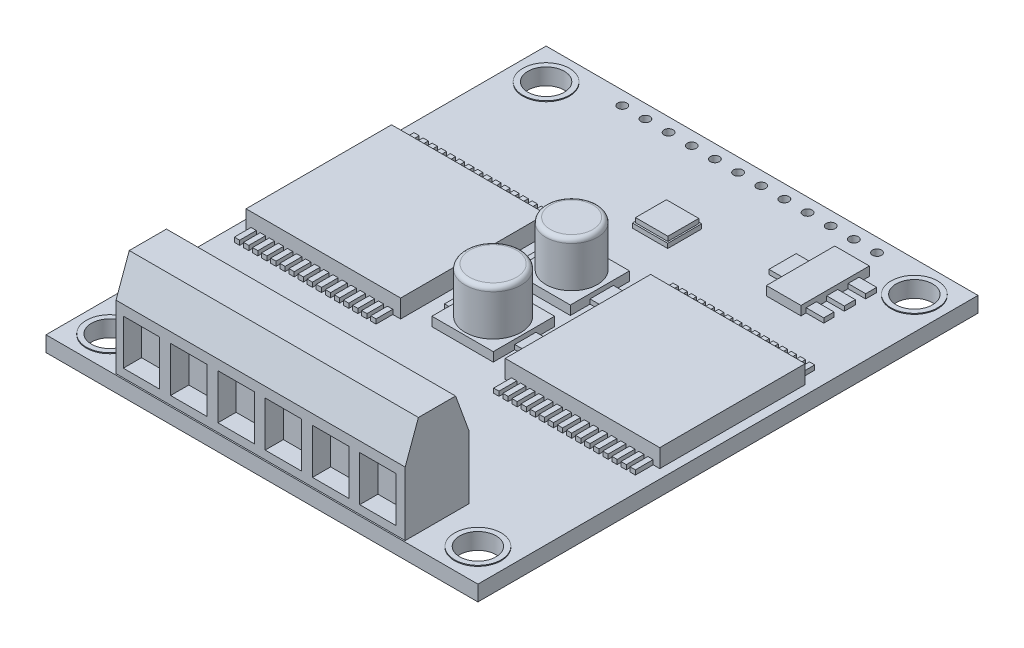
from build123d import *
from OCP.BRepFilletAPI import BRepFilletAPI_MakeChamfer

# Parameters (mm, degrees)
ESBO_O1_W                = 47.5
ESBO_O1_H                = 55
RESSALTO_EXTRUS_O1_DEPTH = 1.7
ESBO_O2_R                = 2
ESBO_O2_R_2              = 1.25
ESBO_O2_R_3              = 0.5
CORTE_EXTRUS_O1_DEPTH    = 73.692090354
ESBO_O3_W                = 17
ESBO_O3_H                = 16
ESBO_O3_W_2              = 5.212797126
ESBO_O3_H_2              = 4.901585357
ESBO_O3_W_3              = 5.212797125
RESSALTO_EXTRUS_O2_DEPTH = 2
ESBO_O4_W                = 6.746375984
ESBO_O4_H                = 6.746375983
ESBO_O4_W_2              = 6.5
ESBO_O4_H_2              = 6.5
ESBO_O4_W_3              = 3.55801489
ESBO_O4_H_3              = 3.39628694
ESBO_O4_W_4              = 3.800606814
ESBO_O4_H_4              = 7.520349653
RESSALTO_EXTRUS_O3_DEPTH = 1
ESBO_O5_R                = 2.835881987
ESBO_O5_R_2              = 3.075092367
RESSALTO_EXTRUS_O4_DEPTH = 5
ESBO_O6_W                = 3.112117687
ESBO_O6_H                = 0.933635306
ESBO_O6_W_2              = 1.400452959
ESBO_O6_H_2              = 3.423329455
ESBO_O6_W_3              = 1.633861785
ESBO_O6_W_4              = 2.800905918
ESBO_O6_W_5              = 2.334088265
ESBO_O6_H_3              = 2.334088265
ESBO_O6_W_6              = 2.022876496
ESBO_O6_H_4              = 2.567497092
ESBO_O6_W_7              = 2.830239116
ESBO_O6_H_5              = 1.212959621
ESBO_O6_H_6              = 1.212959622
ESBO_O6_H_7              = 1.132095647
ESBO_O6_W_8              = 2.627815609
ESBO_O6_H_8              = 2.991967067
ESBO_O6_W_9              = 3.876988277
ESBO_O6_H_9              = 3.739221997
ESBO_O6_W_10             = 0.584875685
ESBO_O6_H_10             = 2.392673258
ESBO_O6_H_11             = 2.392673259
ESBO_O6_W_11             = 0.584875686
RESSALTO_EXTRUS_O5_DEPTH = 0.5
FILETE1_R                = 0.5
RESSALTO_EXTRUS_O6_START = 0.1
ESBO_O7_R                = 2.561974419
ESBO_O7_R_2              = 2
ESBO_O7_R_3              = 1.492713004
ESBO_O7_R_4              = 1.25
RESSALTO_EXTRUS_O6_DEPTH = 0.1
ESBO_O8_W                = 31.8
ESBO_O8_H                = 7
RESSALTO_EXTRUS_O7_DEPTH = 11
CHANFRO1_SIZE            = 4
CHANFRO1_SIZE2           = 1.455880937
ESBO_O10_W               = 4
ESBO_O10_H               = 4.965045717
CORTE_EXTRUS_O2_DEPTH    = 2


with BuildPart() as part:
    # Esboço1 → Ressalto-extrusão1 (new body)
    with BuildSketch(Plane(origin=(0, 0, 0), x_dir=(1, 0, 0), z_dir=(0, 1, 0))):
        with Locations((23.75, 27.5)):
            Rectangle(ESBO_O1_W, ESBO_O1_H)
    extrude(amount=RESSALTO_EXTRUS_O1_DEPTH)

    # Esboço2 → Corte-extrusão1 (cut, through all)
    with BuildSketch(Plane(origin=(0, 1.7, 0), x_dir=(1, 0, 0), z_dir=(0, 1, 0))):
        with Locations((3.5, 51.5)):
            Circle(ESBO_O2_R)
        with Locations((44, 51.5)):
            Circle(ESBO_O2_R)
        with Locations((3.5, 3.5)):
            Circle(ESBO_O2_R)
        with Locations((44, 3.5)):
            Circle(ESBO_O2_R)
        with Locations((12.5, 4.25)):
            Circle(ESBO_O2_R_2)
        with Locations((17, 4.25)):
            Circle(ESBO_O2_R_2)
        with Locations((21.5, 4.25)):
            Circle(ESBO_O2_R_2)
        with Locations((26, 4.25)):
            Circle(ESBO_O2_R_2)
        with Locations((30.5, 4.25)):
            Circle(ESBO_O2_R_2)
        with Locations((35, 4.25)):
            Circle(ESBO_O2_R_2)
        with Locations((9.862, 53.515053231)):
            Circle(ESBO_O2_R_3)
        with Locations((12.409090909, 53.515053231)):
            Circle(ESBO_O2_R_3)
        with Locations((14.956181818, 53.515053231)):
            Circle(ESBO_O2_R_3)
        with Locations((17.503272727, 53.515053231)):
            Circle(ESBO_O2_R_3)
        with Locations((20.050363636, 53.515053231)):
            Circle(ESBO_O2_R_3)
        with Locations((22.597454545, 53.515053231)):
            Circle(ESBO_O2_R_3)
        with Locations((25.144545455, 53.515053231)):
            Circle(ESBO_O2_R_3)
        with Locations((27.691636364, 53.515053231)):
            Circle(ESBO_O2_R_3)
        with Locations((30.238727273, 53.515053231)):
            Circle(ESBO_O2_R_3)
        with Locations((32.785818182, 53.515053231)):
            Circle(ESBO_O2_R_3)
        with Locations((35.332909091, 53.515053231)):
            Circle(ESBO_O2_R_3)
        with Locations((37.88, 53.515053231)):
            Circle(ESBO_O2_R_3)
    extrude(amount=-CORTE_EXTRUS_O1_DEPTH, mode=Mode.SUBTRACT)

    # Esboço3 → Ressalto-extrusão2 (add)
    with BuildSketch(Plane(origin=(0, 1.7, 0), x_dir=(1, 0, 0), z_dir=(0, 1, 0))):
        with Locations((9.5, 29)):
            Rectangle(ESBO_O3_W, ESBO_O3_H)
        with Locations((38, 29)):
            Rectangle(ESBO_O3_W, ESBO_O3_H)
        with Locations((21.512067959, 10.033239484)):
            Rectangle(ESBO_O3_W_2, ESBO_O3_H_2)
        with Locations((29.136756292, 9.994338013)):
            Rectangle(ESBO_O3_W_3, ESBO_O3_H_2)
    extrude(amount=RESSALTO_EXTRUS_O2_DEPTH)

    # Esboço4 → Ressalto-extrusão3 (add)
    with BuildSketch(Plane(origin=(0, 1.7, 0), x_dir=(1, 0, 0), z_dir=(0, 1, 0))):
        with Locations((23.827802942, 25.360419091)):
            Rectangle(ESBO_O4_W, ESBO_O4_H)
        with Locations((23.75, 33.918742729)):
            Rectangle(ESBO_O4_W_2, ESBO_O4_H_2)
        with Locations((24.033023912, 44.279274764)):
            Rectangle(ESBO_O4_W_3, ESBO_O4_H_3)
        with Locations((37.820331609, 47.069081893)):
            Rectangle(ESBO_O4_W_4, ESBO_O4_H_4)
    extrude(amount=RESSALTO_EXTRUS_O3_DEPTH)

    # Esboço5 → Ressalto-extrusão4 (add)
    with BuildSketch(Plane(origin=(0, 2.7, 0), x_dir=(1, 0, 0), z_dir=(0, 1, 0))):
        with Locations((23.709511319, 34.100766284)):
            Circle(ESBO_O5_R)
        with Locations((23.823248313, 25.349228892)):
            Circle(ESBO_O5_R_2)
    extrude(amount=RESSALTO_EXTRUS_O4_DEPTH)

    # Esboço6 → Ressalto-extrusão5 (add)
    with BuildSketch(Plane(origin=(0, 1.7, 0), x_dir=(1, 0, 0), z_dir=(0, 1, 0))):
        with Locations((32.463929523, 11.3558895)):
            Rectangle(ESBO_O6_W, ESBO_O6_H)
        with Locations((32.463929523, 8.866195351)):
            Rectangle(ESBO_O6_W, ESBO_O6_H)
        with Locations((26.395300033, 10.111042426)):
            Rectangle(ESBO_O6_W_2, ESBO_O6_H_2)
        with Locations((24.022310298, 10.111042426)):
            Rectangle(ESBO_O6_W_3, ESBO_O6_H_2)
        with Locations((18.070385222, 11.3558895)):
            Rectangle(ESBO_O6_W_4, ESBO_O6_H)
        with Locations((18.070385222, 8.866195351)):
            Rectangle(ESBO_O6_W_4, ESBO_O6_H)
        with Locations((26.862117686, 25.516024975)):
            Rectangle(ESBO_O6_W_5, ESBO_O6_H_3)
        with Locations((20.482276429, 25.516024975)):
            Rectangle(ESBO_O6_W_6, ESBO_O6_H_3)
        with Locations((26.862117686, 34.113250084)):
            Rectangle(ESBO_O6_W_5, ESBO_O6_H_4)
        with Locations((20.482276429, 34.113250084)):
            Rectangle(ESBO_O6_W_6, ESBO_O6_H_4)
        with Locations((40.246250852, 49.090681262)):
            Rectangle(ESBO_O6_W_7, ESBO_O6_H_5)
        with Locations((40.246250852, 46.745625994)):
            Rectangle(ESBO_O6_W_7, ESBO_O6_H_6)
        with Locations((40.246250852, 44.441002714)):
            Rectangle(ESBO_O6_W_7, ESBO_O6_H_7)
        with Locations((35.33389617, 46.988217918)):
            Rectangle(ESBO_O6_W_8, ESBO_O6_H_8)
        with Locations((24.038752716, 44.269535185)):
            Rectangle(ESBO_O6_W_9, ESBO_O6_H_9)
        with Locations((2.845211635, 20.357062722)):
            Rectangle(ESBO_O6_W_10, ESBO_O6_H_10)
        with Locations((1.845211635, 20.357062722)):
            Rectangle(ESBO_O6_W_10, ESBO_O6_H_10)
        with Locations((3.845211635, 20.357062722)):
            Rectangle(ESBO_O6_W_10, ESBO_O6_H_10)
        with Locations((4.845211635, 20.357062722)):
            Rectangle(ESBO_O6_W_10, ESBO_O6_H_10)
        with Locations((5.845211635, 20.357062722)):
            Rectangle(ESBO_O6_W_10, ESBO_O6_H_10)
        with Locations((6.845211635, 20.357062722)):
            Rectangle(ESBO_O6_W_10, ESBO_O6_H_10)
        with Locations((7.845211635, 20.357062722)):
            Rectangle(ESBO_O6_W_10, ESBO_O6_H_10)
        with Locations((8.845211635, 20.357062722)):
            Rectangle(ESBO_O6_W_10, ESBO_O6_H_10)
        with Locations((9.845211635, 20.357062722)):
            Rectangle(ESBO_O6_W_10, ESBO_O6_H_10)
        with Locations((10.845211635, 20.357062722)):
            Rectangle(ESBO_O6_W_10, ESBO_O6_H_10)
        with Locations((11.845211635, 20.357062722)):
            Rectangle(ESBO_O6_W_10, ESBO_O6_H_10)
        with Locations((12.845211635, 20.357062722)):
            Rectangle(ESBO_O6_W_10, ESBO_O6_H_10)
        with Locations((13.845211635, 20.357062722)):
            Rectangle(ESBO_O6_W_10, ESBO_O6_H_10)
        with Locations((14.845211635, 20.357062722)):
            Rectangle(ESBO_O6_W_10, ESBO_O6_H_10)
        with Locations((15.845211635, 20.357062722)):
            Rectangle(ESBO_O6_W_10, ESBO_O6_H_10)
        with Locations((16.845211635, 20.357062722)):
            Rectangle(ESBO_O6_W_10, ESBO_O6_H_10)
        with Locations((2.767818388, 37.789317955)):
            Rectangle(ESBO_O6_W_10, ESBO_O6_H_11)
        with Locations((1.767818388, 37.789317955)):
            Rectangle(ESBO_O6_W_10, ESBO_O6_H_11)
        with Locations((3.767818388, 37.789317955)):
            Rectangle(ESBO_O6_W_10, ESBO_O6_H_11)
        with Locations((4.767818388, 37.789317955)):
            Rectangle(ESBO_O6_W_10, ESBO_O6_H_11)
        with Locations((5.767818388, 37.789317955)):
            Rectangle(ESBO_O6_W_10, ESBO_O6_H_11)
        with Locations((6.767818388, 37.789317955)):
            Rectangle(ESBO_O6_W_10, ESBO_O6_H_11)
        with Locations((7.767818388, 37.789317955)):
            Rectangle(ESBO_O6_W_10, ESBO_O6_H_11)
        with Locations((8.767818388, 37.789317955)):
            Rectangle(ESBO_O6_W_10, ESBO_O6_H_11)
        with Locations((9.767818388, 37.789317955)):
            Rectangle(ESBO_O6_W_10, ESBO_O6_H_11)
        with Locations((10.767818388, 37.789317955)):
            Rectangle(ESBO_O6_W_10, ESBO_O6_H_11)
        with Locations((11.767818388, 37.789317955)):
            Rectangle(ESBO_O6_W_10, ESBO_O6_H_11)
        with Locations((12.767818388, 37.789317955)):
            Rectangle(ESBO_O6_W_10, ESBO_O6_H_11)
        with Locations((13.767818388, 37.789317955)):
            Rectangle(ESBO_O6_W_10, ESBO_O6_H_11)
        with Locations((14.767818388, 37.789317955)):
            Rectangle(ESBO_O6_W_10, ESBO_O6_H_11)
        with Locations((15.767818388, 37.789317955)):
            Rectangle(ESBO_O6_W_10, ESBO_O6_H_11)
        with Locations((16.767818388, 37.789317955)):
            Rectangle(ESBO_O6_W_10, ESBO_O6_H_11)
        with Locations((31.485086274, 20.237004075)):
            Rectangle(ESBO_O6_W_10, ESBO_O6_H_10)
        with Locations((30.485086274, 20.237004075)):
            Rectangle(ESBO_O6_W_10, ESBO_O6_H_10)
        with Locations((32.485086274, 20.237004075)):
            Rectangle(ESBO_O6_W_10, ESBO_O6_H_10)
        with Locations((33.485086274, 20.237004075)):
            Rectangle(ESBO_O6_W_10, ESBO_O6_H_10)
        with Locations((34.485086274, 20.237004075)):
            Rectangle(ESBO_O6_W_10, ESBO_O6_H_10)
        with Locations((35.485086274, 20.237004075)):
            Rectangle(ESBO_O6_W_10, ESBO_O6_H_10)
        with Locations((36.485086274, 20.237004075)):
            Rectangle(ESBO_O6_W_10, ESBO_O6_H_10)
        with Locations((37.485086274, 20.237004075)):
            Rectangle(ESBO_O6_W_10, ESBO_O6_H_10)
        with Locations((38.485086274, 20.237004075)):
            Rectangle(ESBO_O6_W_10, ESBO_O6_H_10)
        with Locations((39.485086274, 20.237004075)):
            Rectangle(ESBO_O6_W_10, ESBO_O6_H_10)
        with Locations((40.485086274, 20.237004075)):
            Rectangle(ESBO_O6_W_10, ESBO_O6_H_10)
        with Locations((41.485086274, 20.237004075)):
            Rectangle(ESBO_O6_W_10, ESBO_O6_H_10)
        with Locations((42.485086274, 20.237004075)):
            Rectangle(ESBO_O6_W_10, ESBO_O6_H_10)
        with Locations((43.485086274, 20.237004075)):
            Rectangle(ESBO_O6_W_10, ESBO_O6_H_10)
        with Locations((44.485086274, 20.237004075)):
            Rectangle(ESBO_O6_W_10, ESBO_O6_H_10)
        with Locations((45.485086274, 20.237004075)):
            Rectangle(ESBO_O6_W_10, ESBO_O6_H_10)
        with Locations((31.349394629, 37.707660168)):
            Rectangle(ESBO_O6_W_11, ESBO_O6_H_11)
        with Locations((30.349394629, 37.707660168)):
            Rectangle(ESBO_O6_W_11, ESBO_O6_H_11)
        with Locations((32.349394629, 37.707660168)):
            Rectangle(ESBO_O6_W_11, ESBO_O6_H_11)
        with Locations((33.349394629, 37.707660168)):
            Rectangle(ESBO_O6_W_11, ESBO_O6_H_11)
        with Locations((34.349394629, 37.707660168)):
            Rectangle(ESBO_O6_W_11, ESBO_O6_H_11)
        with Locations((35.349394629, 37.707660168)):
            Rectangle(ESBO_O6_W_11, ESBO_O6_H_11)
        with Locations((36.349394629, 37.707660168)):
            Rectangle(ESBO_O6_W_11, ESBO_O6_H_11)
        with Locations((37.349394629, 37.707660168)):
            Rectangle(ESBO_O6_W_11, ESBO_O6_H_11)
        with Locations((38.349394629, 37.707660168)):
            Rectangle(ESBO_O6_W_11, ESBO_O6_H_11)
        with Locations((39.349394629, 37.707660168)):
            Rectangle(ESBO_O6_W_11, ESBO_O6_H_11)
        with Locations((40.349394629, 37.707660168)):
            Rectangle(ESBO_O6_W_11, ESBO_O6_H_11)
        with Locations((41.349394629, 37.707660168)):
            Rectangle(ESBO_O6_W_11, ESBO_O6_H_11)
        with Locations((42.349394629, 37.707660168)):
            Rectangle(ESBO_O6_W_11, ESBO_O6_H_11)
        with Locations((43.349394629, 37.707660168)):
            Rectangle(ESBO_O6_W_11, ESBO_O6_H_11)
        with Locations((44.349394629, 37.707660168)):
            Rectangle(ESBO_O6_W_11, ESBO_O6_H_11)
        with Locations((45.349394629, 37.707660168)):
            Rectangle(ESBO_O6_W_11, ESBO_O6_H_11)
    extrude(amount=RESSALTO_EXTRUS_O5_DEPTH)

    # Filete1
    filete1_edges = [part.edges().sort_by_distance(p)[0] for p in [
        (20.873629331, 7.7, -34.100766284),
        (20.748155945, 7.7, -25.349228892),
    ]]
    fillet(filete1_edges, radius=FILETE1_R)

    # Esboço7 → Ressalto-extrusão6 (add)
    # profile 1 of 10: a face of its own
    with BuildSketch(Plane(origin=(0, 1.7, 0), x_dir=(1, 0, 0), z_dir=(0, 1, 0)).offset(RESSALTO_EXTRUS_O6_START)):
        with Locations((3.5, 3.5)):
            Circle(ESBO_O7_R)
        with Locations((3.5, 3.5)):
            Circle(ESBO_O7_R_2, mode=Mode.SUBTRACT)
    # profile 2 of 10: a face of its own
    with BuildSketch(Plane(origin=(0, 1.7, 0), x_dir=(1, 0, 0), z_dir=(0, 1, 0)).offset(RESSALTO_EXTRUS_O6_START)):
        with Locations((12.5, 4.25)):
            Circle(ESBO_O7_R_3)
        with Locations((12.5, 4.25)):
            Circle(ESBO_O7_R_4, mode=Mode.SUBTRACT)
    # profile 3 of 10: a face of its own
    with BuildSketch(Plane(origin=(0, 1.7, 0), x_dir=(1, 0, 0), z_dir=(0, 1, 0)).offset(RESSALTO_EXTRUS_O6_START)):
        with Locations((44, 3.5)):
            Circle(ESBO_O7_R)
        with Locations((44, 3.5)):
            Circle(ESBO_O7_R_2, mode=Mode.SUBTRACT)
    # profile 4 of 10: a face of its own
    with BuildSketch(Plane(origin=(0, 1.7, 0), x_dir=(1, 0, 0), z_dir=(0, 1, 0)).offset(RESSALTO_EXTRUS_O6_START)):
        with Locations((3.5, 51.5)):
            Circle(ESBO_O7_R)
        with Locations((3.5, 51.5)):
            Circle(ESBO_O7_R_2, mode=Mode.SUBTRACT)
    # profile 5 of 10: a face of its own
    with BuildSketch(Plane(origin=(0, 1.7, 0), x_dir=(1, 0, 0), z_dir=(0, 1, 0)).offset(RESSALTO_EXTRUS_O6_START)):
        with Locations((44, 51.5)):
            Circle(ESBO_O7_R)
        with Locations((44, 51.5)):
            Circle(ESBO_O7_R_2, mode=Mode.SUBTRACT)
    # profile 6 of 10: a face of its own
    with BuildSketch(Plane(origin=(0, 1.7, 0), x_dir=(1, 0, 0), z_dir=(0, 1, 0)).offset(RESSALTO_EXTRUS_O6_START)):
        with Locations((17, 4.25)):
            Circle(ESBO_O7_R_3)
        with Locations((17, 4.25)):
            Circle(ESBO_O7_R_4, mode=Mode.SUBTRACT)
    # profile 7 of 10: a face of its own
    with BuildSketch(Plane(origin=(0, 1.7, 0), x_dir=(1, 0, 0), z_dir=(0, 1, 0)).offset(RESSALTO_EXTRUS_O6_START)):
        with Locations((21.5, 4.25)):
            Circle(ESBO_O7_R_3)
        with Locations((21.5, 4.25)):
            Circle(ESBO_O7_R_4, mode=Mode.SUBTRACT)
    # profile 8 of 10: a face of its own
    with BuildSketch(Plane(origin=(0, 1.7, 0), x_dir=(1, 0, 0), z_dir=(0, 1, 0)).offset(RESSALTO_EXTRUS_O6_START)):
        with Locations((26, 4.25)):
            Circle(ESBO_O7_R_3)
        with Locations((26, 4.25)):
            Circle(ESBO_O7_R_4, mode=Mode.SUBTRACT)
    # profile 9 of 10: a face of its own
    with BuildSketch(Plane(origin=(0, 1.7, 0), x_dir=(1, 0, 0), z_dir=(0, 1, 0)).offset(RESSALTO_EXTRUS_O6_START)):
        with Locations((30.5, 4.25)):
            Circle(ESBO_O7_R_3)
        with Locations((30.5, 4.25)):
            Circle(ESBO_O7_R_4, mode=Mode.SUBTRACT)
    # profile 10 of 10: a face of its own
    with BuildSketch(Plane(origin=(0, 1.7, 0), x_dir=(1, 0, 0), z_dir=(0, 1, 0)).offset(RESSALTO_EXTRUS_O6_START)):
        with Locations((35, 4.25)):
            Circle(ESBO_O7_R_3)
        with Locations((35, 4.25)):
            Circle(ESBO_O7_R_4, mode=Mode.SUBTRACT)
    extrude(amount=-RESSALTO_EXTRUS_O6_DEPTH)

    # Esboço8 → Ressalto-extrusão7 (add)
    with BuildSketch(Plane(origin=(0, 1.7, 0), x_dir=(1, 0, 0), z_dir=(0, 1, 0))):
        with Locations((23.454610216, 3.64711468)):
            Rectangle(ESBO_O8_W, ESBO_O8_H)
    extrude(amount=RESSALTO_EXTRUS_O7_DEPTH)

    # Chanfro1: one chamfer whose edges measure the first distance from different faces: ONE call of the kernel's chamfer builder (chamfer() names one face for all edges)
    chanfro1_edges_1 = [part.edges().sort_by_distance(p)[0] for p in [
        (23.454610216, 12.7, -7.14711468),
    ]]
    chanfro1_side_1 = [part.faces().sort_by_distance(p)[0] for p in [
        (23.454610216, 7.2, -7.14711468),
    ]]
    chanfro1_edges_2 = [part.edges().sort_by_distance(p)[0] for p in [
        (23.454610216, 12.7, -0.14711468),
    ]]
    chanfro1_side_2 = [part.faces().sort_by_distance(p)[0] for p in [
        (23.454610216, 7.2, -0.14711468),
    ]]
    chanfro1 = BRepFilletAPI_MakeChamfer(part.part.solid().wrapped)
    for e in chanfro1_edges_1:
        chanfro1.Add(CHANFRO1_SIZE, CHANFRO1_SIZE2, e.wrapped, chanfro1_side_1[0].wrapped)  # the first distance lies on this face
    for e in chanfro1_edges_2:
        chanfro1.Add(CHANFRO1_SIZE, CHANFRO1_SIZE2, e.wrapped, chanfro1_side_2[0].wrapped)  # the first distance lies on this face
    add(Compound.cast(chanfro1.Shape()), mode=Mode.REPLACE)

    # Esboço10 → Corte-extrusão2 (cut)
    with BuildSketch(Plane.XY.offset(-0.14711468)):
        with Locations((15.558030856, 5.103021277)):
            Rectangle(ESBO_O10_W, ESBO_O10_H)
        with Locations((10.358030856, 5.103021277)):
            Rectangle(ESBO_O10_W, ESBO_O10_H)
        with Locations((20.758030856, 5.103021277)):
            Rectangle(ESBO_O10_W, ESBO_O10_H)
        with Locations((25.958030856, 5.103021277)):
            Rectangle(ESBO_O10_W, ESBO_O10_H)
        with Locations((31.158030856, 5.103021277)):
            Rectangle(ESBO_O10_W, ESBO_O10_H)
        with Locations((36.358030856, 5.103021277)):
            Rectangle(ESBO_O10_W, ESBO_O10_H)
    extrude(amount=-CORTE_EXTRUS_O2_DEPTH, mode=Mode.SUBTRACT)


solid = part.part
